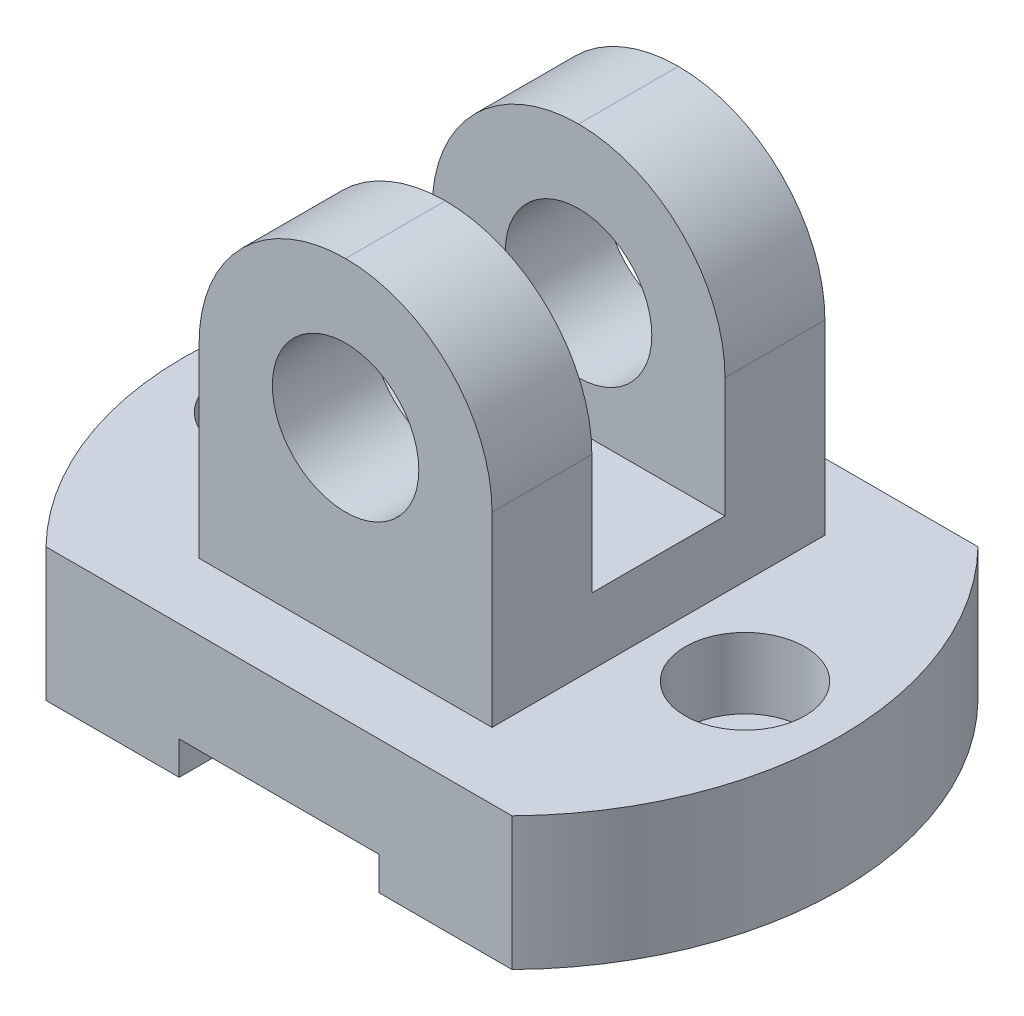
from build123d import *

# Parameters (mm, degrees)
ESTRUSIONE_ESTRUSIONE1_DEPTH                         = 35
ESTRUSIONE_ESTRUSIONE2_DEPTH                         = 22
ESTRUSIONE_ESTRUSIONE3_DEPTH                         = 20
TAGLIO_ESTRUSIONE1_DEPTH                             = 111.588362117
TAGLIO_ESTRUSIONE1_DEPTH_BACK                        = 111.588362117
SCHIZZO3_W                                           = 30
SCHIZZO3_H                                           = 5
FORO_22_0_22_1_D                                     = 22
FORO_LAMATO_PER_VITE_M10_A_TESTA_CILINDR_D           = 11
FORO_LAMATO_PER_VITE_M10_A_TESTA_CILINDR_CBORE_D     = 18
FORO_LAMATO_PER_VITE_M10_A_TESTA_CILINDR_CBORE_DEPTH = 10.6
FORO_16_0_16_1_D                                     = 16
RACCORDO1_R                                          = 22


with BuildPart() as part:
    # Schizzo1 → Estrusione-Estrusione1 (new, symmetric)
    with BuildSketch(Plane(origin=(0, 0, 0), x_dir=(0, 0, -1), z_dir=(1, 0, 0))):
        Polygon((0, 0), (0, 20), (-25, 20), (-35, 20), (-35, 0), align=None)
        Polygon((25, 20), (0, 20), (0, 0), (35, 0), (35, 20), align=None)
    extrude(amount=ESTRUSIONE_ESTRUSIONE1_DEPTH, both=True)

    # Schizzo1<3> → Estrusione-Estrusione2 (add, symmetric)
    with BuildSketch(Plane(origin=(0, 0, 0), x_dir=(0, 0, -1), z_dir=(1, 0, 0))):
        Polygon((0, 20), (0, 30), (-10, 30), (-10, 70), (-25, 70), (-25, 20), align=None)
        Polygon((10, 30), (0, 30), (0, 20), (25, 20), (25, 70), (10, 70), align=None)
    extrude(amount=ESTRUSIONE_ESTRUSIONE2_DEPTH, both=True)

    # Schizzo2 → Estrusione-Estrusione3 (add)
    with BuildSketch(Plane.XZ):
        with BuildLine():
            Line((-35, 35), (-35, -35))
            ThreePointArc((-35, -35), (-49.292857857, 0), (-35, 35))
        make_face()
        with BuildLine():
            Line((35, 35), (35, -35))
            ThreePointArc((35, -35), (49.292857857, 0), (35, 35))
        make_face()
    extrude(amount=-ESTRUSIONE_ESTRUSIONE3_DEPTH)

    # Schizzo3 → Taglio-Estrusione1 (cut, two sides: drawn at the far end of the back side and taken through both)
    with BuildSketch(Plane(origin=(0, 0, -35), x_dir=(-1, 0, 0), z_dir=(0, 0, -1)).offset(-TAGLIO_ESTRUSIONE1_DEPTH_BACK)):
        with Locations((0, 2.5)):
            Rectangle(SCHIZZO3_W, SCHIZZO3_H)
    extrude(amount=TAGLIO_ESTRUSIONE1_DEPTH + TAGLIO_ESTRUSIONE1_DEPTH_BACK, mode=Mode.SUBTRACT)

    # Foro Ø22.0 (22)-1 (through all)
    with Locations(Plane.XY.offset(25)):
        with Locations((0, 48)):
            Hole(FORO_22_0_22_1_D / 2)

    # Foro lamato per Vite M10 a testa cilindrica-1 (through all)
    with Locations(Plane(origin=(0, 20, 0), x_dir=(1, 0, 0), z_dir=(0, 1, 0))):
        with Locations((35, 0), (-35, 0)):
            CounterBoreHole(FORO_LAMATO_PER_VITE_M10_A_TESTA_CILINDR_D / 2, FORO_LAMATO_PER_VITE_M10_A_TESTA_CILINDR_CBORE_D / 2, FORO_LAMATO_PER_VITE_M10_A_TESTA_CILINDR_CBORE_DEPTH)

    # Foro Ø16.0 (16)-1 (through all)
    with Locations(Plane(origin=(0, 30, 0), x_dir=(1, 0, 0), z_dir=(0, 1, 0))):
        with Locations((0, 0)):
            Hole(FORO_16_0_16_1_D / 2)

    # Raccordo1
    raccordo1_edges = [part.edges().sort_by_distance(p)[0] for p in [
        (-22, 70, 17.5),
        (22, 70, 17.5),
        (-22, 70, -17.5),
        (22, 70, -17.5),
    ]]
    fillet(raccordo1_edges, radius=RACCORDO1_R - 0.0001)  # a hair under: the kernel refuses the full size


solid = part.part
